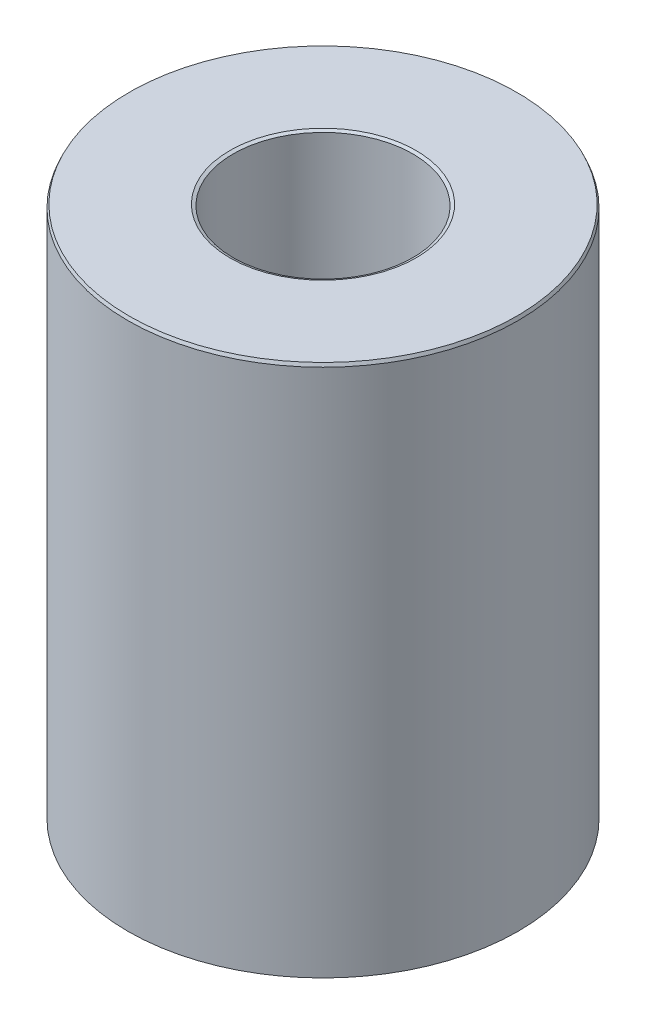
from build123d import *
from OCP.BRepFilletAPI import BRepFilletAPI_MakeChamfer

# Parameters (mm, degrees)
SKETCH1_R           = 40
BOSS_EXTRUDE1_DEPTH = 109.313836676
SKETCH2_R           = 18.422054599
CUT_EXTRUDE1_DEPTH  = 124.083365606
CHAMFER1_SIZE       = 0.653454752
CHAMFER1_SIZE2      = 0.276940419


with BuildPart() as part:
    # Sketch1 → Boss-Extrude1 (new body)
    with BuildSketch(Plane(origin=(0, 0, 0), x_dir=(1, 0, 0), z_dir=(0, 1, 0))):
        Circle(SKETCH1_R)
    extrude(amount=BOSS_EXTRUDE1_DEPTH)

    # Sketch2 → Cut-Extrude1 (cut, through all)
    with BuildSketch(Plane(origin=(0, 0, 0), x_dir=(1, 0, 0), z_dir=(0, 1, 0))):
        Circle(SKETCH2_R)
    extrude(amount=CUT_EXTRUDE1_DEPTH, mode=Mode.SUBTRACT)

    # Chamfer1: one chamfer whose edges measure the first distance from different faces: ONE call of the kernel's chamfer builder (chamfer() names one face for all edges)
    chamfer1_edges_1 = [part.edges().sort_by_distance(p)[0] for p in [
        (-18.422054599, 109.313836676, 0),
    ]]
    chamfer1_side_1 = [part.faces().sort_by_distance(p)[0] for p in [
        (-38.86862915, 109.313836676, 0),
    ]]
    chamfer1_edges_2 = [part.edges().sort_by_distance(p)[0] for p in [
        (-18.422054599, 0, 0),
    ]]
    chamfer1_side_2 = [part.faces().sort_by_distance(p)[0] for p in [
        (-18.422054599, 54.656918338, 0),
    ]]
    chamfer1_edges_3 = [part.edges().sort_by_distance(p)[0] for p in [
        (-40, 0, 0),
    ]]
    chamfer1_side_3 = [part.faces().sort_by_distance(p)[0] for p in [
        (-38.86862915, 0, 0),
    ]]
    chamfer1_edges_4 = [part.edges().sort_by_distance(p)[0] for p in [
        (-40, 109.313836676, 0),
    ]]
    chamfer1_side_4 = [part.faces().sort_by_distance(p)[0] for p in [
        (-40, 54.656918338, 0),
    ]]
    chamfer1 = BRepFilletAPI_MakeChamfer(part.part.solid().wrapped)
    for e in chamfer1_edges_1:
        chamfer1.Add(CHAMFER1_SIZE, CHAMFER1_SIZE2, e.wrapped, chamfer1_side_1[0].wrapped)  # the first distance lies on this face
    for e in chamfer1_edges_2:
        chamfer1.Add(CHAMFER1_SIZE, CHAMFER1_SIZE2, e.wrapped, chamfer1_side_2[0].wrapped)  # the first distance lies on this face
    for e in chamfer1_edges_3:
        chamfer1.Add(CHAMFER1_SIZE, CHAMFER1_SIZE2, e.wrapped, chamfer1_side_3[0].wrapped)  # the first distance lies on this face
    for e in chamfer1_edges_4:
        chamfer1.Add(CHAMFER1_SIZE, CHAMFER1_SIZE2, e.wrapped, chamfer1_side_4[0].wrapped)  # the first distance lies on this face
    add(Compound.cast(chamfer1.Shape()), mode=Mode.REPLACE)


solid = part.part
